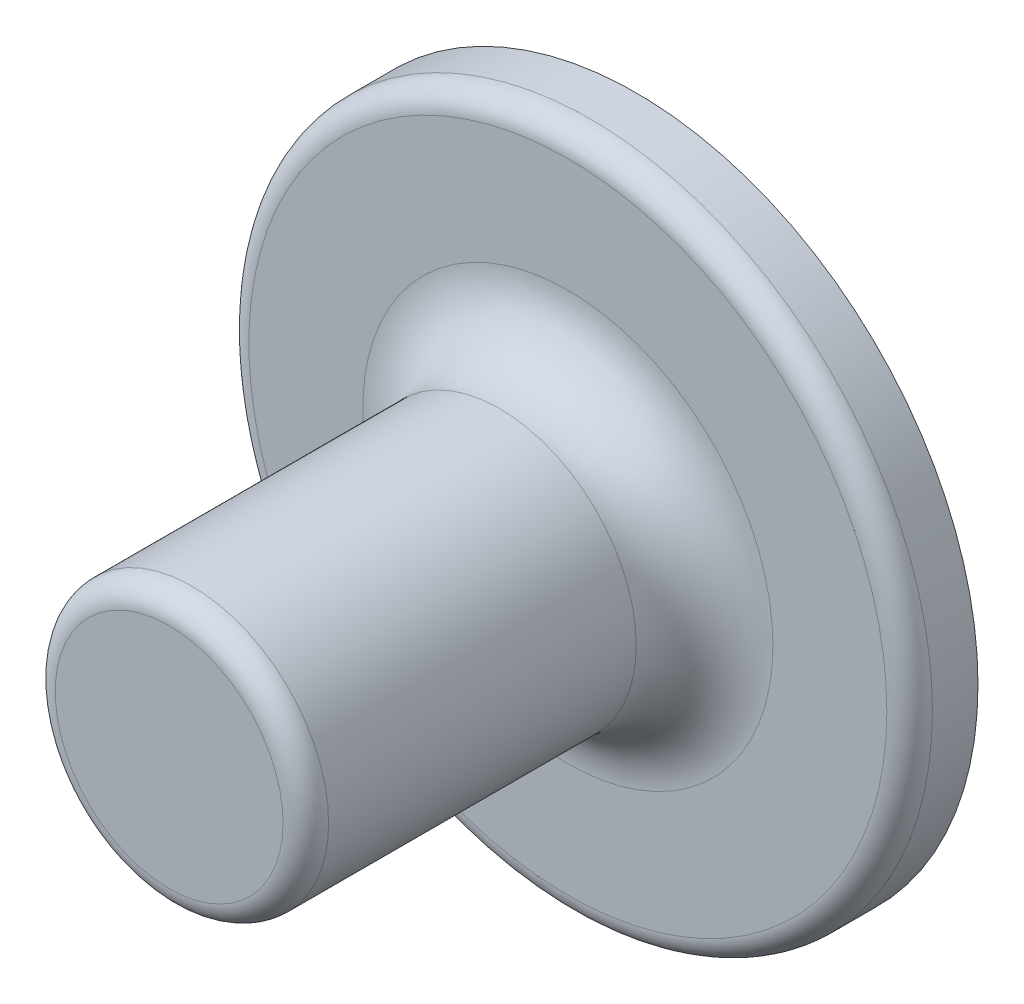
from build123d import *

# Parameters (mm, degrees)
SKETCH_1_R      = 15
EXTRUDE_1_DEPTH = 3
SKETCH_2_R      = 6
EXTRUDE_2_DEPTH = 17.5
FILLET_1_R      = 3
FILLET_2_R      = 1
FILLET_3_R      = 1


with BuildPart() as part:
    # 草图1 → 凸台-拉伸1 (new body)
    with BuildSketch(Plane.XY):
        Circle(SKETCH_1_R)
    extrude(amount=EXTRUDE_1_DEPTH)

    # 草图2 → 凸台-拉伸2 (add)
    with BuildSketch(Plane.XY.offset(3)):
        Circle(SKETCH_2_R)
    extrude(amount=EXTRUDE_2_DEPTH)

    # 圆角1
    fillet_1_edges = [part.edges().sort_by_distance(p)[0] for p in [
        (-6, 0, 3),
    ]]
    fillet(fillet_1_edges, radius=FILLET_1_R)

    # 圆角2
    fillet_2_edges = [part.edges().sort_by_distance(p)[0] for p in [
        (-15, 0, 3),
    ]]
    fillet(fillet_2_edges, radius=FILLET_2_R)

    # 圆角3
    fillet_3_edges = [part.edges().sort_by_distance(p)[0] for p in [
        (-6, 0, 20.5),
    ]]
    fillet(fillet_3_edges, radius=FILLET_3_R)


solid = part.part
